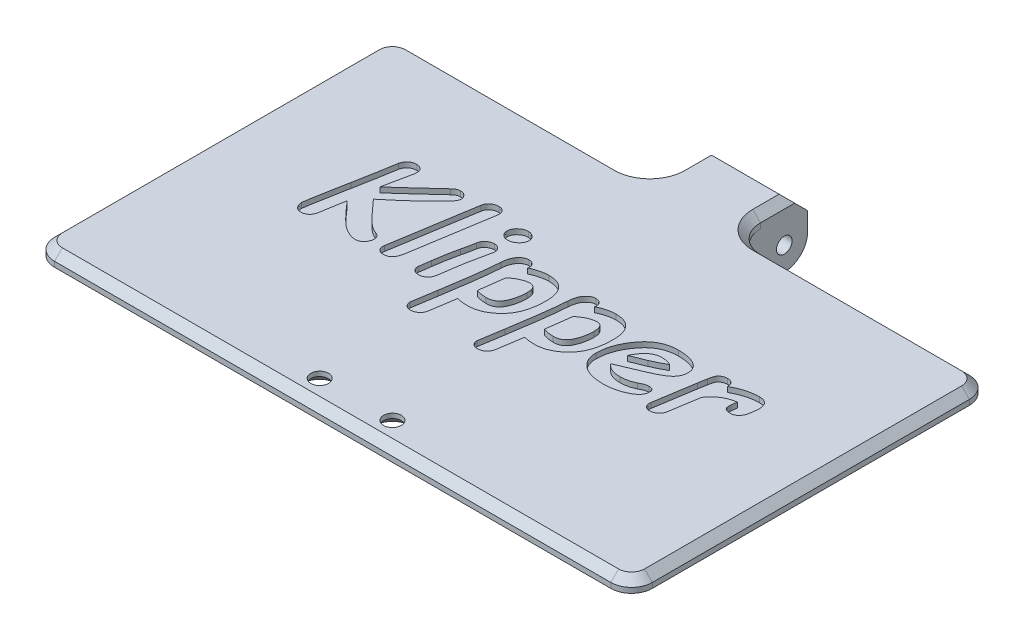
from build123d import *

# Parameters (mm, degrees)
SKETCH_1_W               = 115
SKETCH_1_H               = 69
EXTRUDE_1_DEPTH          = 2.5
SKETCH_2_W               = 16
SKETCH_2_H               = 9.88
EXTRUDE_2_DEPTH          = 2.5
EXTRUDE_3_DEPTH          = 8
EXTRUDE_3_DEPTH_BACK     = 8
SKETCH_3_R               = 4.5
SKETCH_3_R_2             = 1.5
EXTRUDE_4_DEPTH          = 16
FILLET_1_R               = 4
FILLET_2_R               = 5.3
CHAMFER_3_SIZE           = 4
CHAMFER_4_SIZE           = 5
CUT_EXTRUDE_1_REACH      = 78.064
SKETCH_5_W               = 6.532207719
SKETCH_5_H               = 9.476044153
SKETCH_5_W_2             = 6.58802864
CHAMFER_5_SIZE           = 1.5
CUT_EXTRUDE_2_DEPTH      = 1
SKETCH_7_R               = 1.5
CUT_EXTRUDE_3_DEPTH      = 10
HOLE_WIZARD_1_AT_2_COUNT = 2
HOLE_WIZARD_1_AT_2_PITCH = 14


with BuildPart() as part:
    # 草图1 → 凸台-拉伸1 (new body)
    with BuildSketch(Plane(origin=(0, 0, 0), x_dir=(1, 0, 0), z_dir=(0, 1, 0))):
        Rectangle(SKETCH_1_W, SKETCH_1_H)
    extrude(amount=EXTRUDE_1_DEPTH)

    # 草图2 → 凸台-拉伸2 (add)
    with BuildSketch(Plane(origin=(0, 2.5, 0), x_dir=(1, 0, 0), z_dir=(0, 1, 0))):
        with Locations((0, 39.44)):
            Rectangle(SKETCH_2_W, SKETCH_2_H)
    extrude(amount=-EXTRUDE_2_DEPTH)



with BuildPart() as body_2:
    # 草图3 → 凸台-拉伸3 (new, two sides: drawn at the far end of the back side and taken through both)
    with BuildSketch(Plane(origin=(0, 0, 0), x_dir=(0, 0, -1), z_dir=(1, 0, 0)).offset(-EXTRUDE_3_DEPTH_BACK)):
        with Locations((44.38, -5)):
            Circle(SKETCH_3_R)
        with Locations((44.38, -5)):
            Circle(SKETCH_3_R_2, mode=Mode.SUBTRACT)
    extrude(amount=EXTRUDE_3_DEPTH + EXTRUDE_3_DEPTH_BACK)


with BuildPart() as part_1:
    add(part.part)

    add(body_2.part)  # 凸台-拉伸4 merges body 2
    # 草图4 → 凸台-拉伸4 (add)
    with BuildSketch(Plane(origin=(8, 0, 0), x_dir=(0, 0, -1), z_dir=(1, 0, 0))):
        with BuildLine():
            Line((39.88, -5), (39.88, 2.5))
            Line((39.88, 2.5), (44.38, 2.5))
            Line((44.38, 2.5), (48.88, 2.5))
            Line((48.88, 2.5), (48.88, -5))
            Line((48.88, -5), (45.88, -5))
            ThreePointArc((45.88, -5), (44.38, -3.5), (42.88, -5))
            Line((42.88, -5), (39.88, -5))
        make_face()
    extrude(amount=-EXTRUDE_4_DEPTH)

    # 圆角1
    fillet_1_edges = [part_1.edges().sort_by_distance(p)[0] for p in [
        (57.5, 1.25, 34.5),
        (-57.5, 1.25, 34.5),
        (-57.5, 1.25, -34.5),
        (57.5, 1.25, -34.5),
    ]]
    fillet(fillet_1_edges, radius=FILLET_1_R)

    # 圆角2
    fillet_2_edges = [part_1.edges().sort_by_distance(p)[0] for p in [
        (8, 1.25, -34.5),
        (-8, 1.25, -34.5),
    ]]
    fillet(fillet_2_edges, radius=FILLET_2_R)

    # 倒角3
    chamfer_3_edges = [part_1.edges().sort_by_distance(p)[0] for p in [
        (0, 2.5, -48.88),
    ]]
    chamfer(chamfer_3_edges, length=CHAMFER_3_SIZE)

    # 倒角4
    chamfer_4_edges = [part_1.edges().sort_by_distance(p)[0] for p in [
        (0, 0, -39.88),
    ]]
    chamfer(chamfer_4_edges, length=CHAMFER_4_SIZE - 0.0001)  # a hair under: the kernel refuses the full size

    # 草图5 → 切除-拉伸1 (cut, up to next)
    with BuildSketch(Plane.XY, mode=Mode.PRIVATE) as cut_extrude_1_sk1:
        with Locations((-11.266103859, -4.738022077)):
            Rectangle(SKETCH_5_W, SKETCH_5_H)
    cut_extrude_1_tool1 = extrude(cut_extrude_1_sk1.sketch, amount=-CUT_EXTRUDE_1_REACH, mode=Mode.PRIVATE) & part_1.part
    # 草图5 → 切除-拉伸1 (cut, up to next)
    with BuildSketch(Plane.XY, mode=Mode.PRIVATE) as cut_extrude_1_sk2:
        with Locations((11.29401432, -4.738022077)):
            Rectangle(SKETCH_5_W_2, SKETCH_5_H)
    cut_extrude_1_tool2 = extrude(cut_extrude_1_sk2.sketch, amount=-CUT_EXTRUDE_1_REACH, mode=Mode.PRIVATE) & part_1.part
    add(cut_extrude_1_tool1.solids().sort_by_distance((-11.266104, -4.738022, 0))[0], mode=Mode.SUBTRACT)
    add(cut_extrude_1_tool2.solids().sort_by_distance((11.294014, -4.738022, 0))[0], mode=Mode.SUBTRACT)

    # 倒角5
    chamfer_5_edges = [part_1.edges().sort_by_distance(p)[0] for p in [
        (-8, 2.5, -42.34),
        (-57.5, 2.5, 0),
        (0, 2.5, 34.5),
        (57.5, 2.5, 0),
        (33.4, 2.5, -34.5),
        (56.328427125, 2.5, -33.328427125),
        (56.328427125, 2.5, 33.328427125),
        (-56.328427125, 2.5, 33.328427125),
        (-56.328427125, 2.5, -33.328427125),
        (-33.4, 2.5, -34.5),
        (8, 2.5, -42.34),
        (-9.55233406, 2.5, -36.05233406),
        (9.55233406, 2.5, -36.05233406),
    ]]
    chamfer(chamfer_5_edges, length=CHAMFER_5_SIZE)

    # 草图6 → 切除-拉伸2 (cut)
    # profile 1 of 8: a face of its own
    with BuildSketch(Plane(origin=(0, 2.5, 0), x_dir=(1, 0, 0), z_dir=(0, 1, 0))):
        with BuildLine():
            add(Edge.make_bspline(
                [(-34.7596989, -2.580431476), (-34.782081576, -2.68550518), (-34.826132819, -2.892300257), (-34.945223634, -3.185436858), (-35.116235559, -3.449182579), (-35.326182391, -3.683516785), (-35.570955763, -3.881601483), (-35.853189501, -4.017486584), (-36.159254779, -4.104849167), (-36.373448453, -4.114555759), (-36.482918356, -4.119516594)],
                knots=[0, 0, 0, 0, 1.021134815, 2.009690762, 2.99109389, 3.997912883, 4.994545801, 5.96555881, 6.960239698, 8, 8, 8, 8], degree=3))
            add(Edge.make_bspline(
                [(-36.482918356, -4.119516594), (-36.605371635, -4.113559535), (-36.837602445, -4.102262061), (-37.163298989, -3.997139622), (-37.441921766, -3.825227549), (-37.65872389, -3.582885479), (-37.824427553, -3.309599327), (-37.951994439, -3.025545741), (-38.028997049, -2.730361229), (-38.038219633, -2.531071917), (-38.042848871, -2.431039466)],
                knots=[0, 0, 0, 0, 1.14141121, 2.164669263, 3.161492256, 4.164639142, 5.170642093, 6.139766002, 7.066263201, 8, 8, 8, 8], degree=3))
            add(Edge.make_bspline(
                [(-38.042848871, -2.431039466), (-38.040602786, -2.39976677), (-38.034773977, -2.318611052), (-38.021390307, -2.168853523), (-37.992565285, -1.965021224), (-37.948624946, -1.707496228), (-37.901468877, -1.394392395), (-37.843018925, -1.026974693), (-37.768363311, -0.605910492), (-37.685481927, -0.129855686), (-37.591211461, 0.401619914), (-37.488404274, 0.98807478), (-37.368788027, 1.628012317), (-37.239466719, 2.322504999), (-37.105823889, 3.073699869), (-36.956541285, 3.878598476), (-36.791019208, 4.737034111), (-36.68171095, 5.328005545), (-36.625361899, 5.632654801)],
                knots=[0, 0, 0, 0, 0.183784855, 0.47693975, 0.881111405, 1.390003718, 2.00829355, 2.737042932, 3.570699548, 4.514851944, 5.569501986, 6.734651007, 8.004833705, 9.385520732, 10.875491024, 12.477186854, 14.183969069, 16, 16, 16, 16], degree=3))
            add(Edge.make_bspline(
                [(-36.625361899, 5.632654801), (-36.549574675, 6.023987802), (-36.401883005, 6.786604789), (-36.194652462, 7.902290306), (-35.998775911, 8.960535439), (-35.819322211, 9.961339889), (-35.651846282, 10.905049524), (-35.498183921, 11.789505576), (-35.362860156, 12.617777346), (-35.279400908, 13.150851173), (-35.239143023, 13.407987748)],
                knots=[0, 0, 0, 0, 1.21119589, 2.360339037, 3.448096115, 4.481401348, 5.449877681, 6.360467923, 7.209145824, 8, 8, 8, 8], degree=3))
            add(Edge.make_bspline(
                [(-35.239143023, 13.407987748), (-35.212861345, 13.515801404), (-35.1606366, 13.730039656), (-35.014159889, 14.029055053), (-34.814464878, 14.300708642), (-34.570961605, 14.54338601), (-34.292858529, 14.749143256), (-33.985513746, 14.897227963), (-33.657737043, 14.987946932), (-33.431956683, 14.997722147), (-33.317892299, 15.002660592)],
                knots=[0, 0, 0, 0, 0.984283338, 1.955885296, 2.936121954, 3.969883521, 5.001592343, 5.996213444, 6.987685735, 8, 8, 8, 8], degree=3))
            add(Edge.make_bspline(
                [(-33.317892299, 15.002660592), (-33.222570261, 14.997785719), (-33.036224117, 14.988255775), (-32.767380287, 14.919531757), (-32.527037782, 14.793360001), (-32.316109996, 14.627431), (-32.138756296, 14.425356071), (-32.013882693, 14.188278886), (-31.932707355, 13.925075428), (-31.925150105, 13.739822271), (-31.921250724, 13.644235577)],
                knots=[0, 0, 0, 0, 1.0498553, 2.052374159, 3.027991965, 4.018179449, 4.99504746, 5.965312959, 6.9501447, 8, 8, 8, 8], degree=3))
            add(Edge.make_bspline(
                [(-31.921250724, 13.644235577), (-31.922116159, 13.610638789), (-31.924059012, 13.535215938), (-31.934670223, 13.409840336), (-31.956669919, 13.261808223), (-31.985423722, 13.08824812), (-32.019092809, 12.890009602), (-32.061736996, 12.666666262), (-32.109346514, 12.419526595), (-32.147768258, 12.247497), (-32.167921251, 12.15726395)],
                knots=[0, 0, 0, 0, 0.534416193, 1.199733496, 1.99934538, 2.913736552, 3.997694676, 5.19693574, 6.529735328, 8, 8, 8, 8], degree=3))
            Line((-32.167921251, 12.15726395), (-33.095541401, 7.710246))
            add(Edge.make_bspline(
                [(-33.095541401, 7.710246), (-33.071091839, 7.728609765), (-33.00454831, 7.778589789), (-32.883138016, 7.880929526), (-32.714196479, 8.030643251), (-32.493802321, 8.22597191), (-32.225497984, 8.468555864), (-31.902027899, 8.753930185), (-31.53441054, 9.090753257), (-31.111443168, 9.468898957), (-30.642762395, 9.896625222), (-30.127432586, 10.372818479), (-29.557017325, 10.890730575), (-28.942757304, 11.461558992), (-28.269443882, 12.069775913), (-27.555548284, 12.733201926), (-26.78610713, 13.436592624), (-26.259148145, 13.924206493), (-25.987261146, 14.175793191)],
                knots=[0, 0, 0, 0, 0.152717834, 0.415646855, 0.792756665, 1.280347358, 1.886599977, 2.599491844, 3.434921134, 4.376976659, 5.43342272, 6.604286436, 7.881753593, 9.281818112, 10.792750873, 12.413843217, 14.14970533, 16, 16, 16, 16], degree=3))
            add(Edge.make_bspline(
                [(-25.987261146, 14.175793191), (-25.885998351, 14.267633275), (-25.691113446, 14.444383736), (-25.359691347, 14.639661489), (-25.010686848, 14.757406286), (-24.772139196, 14.772687626), (-24.653155761, 14.780309694)],
                knots=[0, 0, 0, 0, 1.089728316, 2.097232233, 3.05093241, 4, 4, 4, 4], degree=3))
            add(Edge.make_bspline(
                [(-24.653155761, 14.780309694), (-24.556563292, 14.775896314), (-24.368534961, 14.767305162), (-24.098196654, 14.692455059), (-23.854039911, 14.564514198), (-23.640771895, 14.389828039), (-23.459360049, 14.184988788), (-23.329279736, 13.950015895), (-23.243395642, 13.695277316), (-23.235972133, 13.516389126), (-23.232194557, 13.425358912)],
                knots=[0, 0, 0, 0, 1.060102912, 2.063612007, 3.054123836, 4.067830886, 5.078337085, 6.041320095, 7.003293336, 8, 8, 8, 8], degree=3))
            add(Edge.make_bspline(
                [(-23.232194557, 13.425358912), (-23.240692459, 13.343162794), (-23.259772507, 13.158610653), (-23.400493081, 12.875453989), (-23.598094373, 12.547253275), (-23.830005672, 12.250451162), (-24.068551177, 11.977201758), (-24.302183975, 11.725300705), (-24.5791008, 11.427902188), (-24.910250107, 11.097605087), (-25.286157797, 10.723043509), (-25.713987826, 10.312474589), (-26.185229964, 9.855993865), (-26.890442577, 9.189812212), (-27.837820725, 8.313627894), (-29.046952507, 7.240885452), (-30.337872929, 6.139156433), (-31.231119423, 5.402066765), (-31.688477128, 5.024664066)],
                knots=[0, 0, 0, 0, 0.327637796, 0.735633966, 1.243936428, 1.860776083, 2.234417901, 2.692570758, 3.232289055, 3.856775775, 4.55973, 5.351061715, 6.224176387, 7.17923422, 9.224317807, 11.376173153, 13.632520422, 16, 16, 16, 16], degree=3))
            add(Edge.make_bspline(
                [(-31.688477128, 5.024664066), (-31.466252324, 4.776721822), (-31.040991767, 4.302247077), (-30.430471217, 3.62507098), (-29.873079951, 3.013979543), (-29.367347473, 2.472677522), (-28.920496522, 1.992042784), (-28.518567772, 1.587751149), (-28.17767055, 1.242966951), (-27.801115117, 0.883321867), (-27.376640141, 0.51572459), (-26.885356644, 0.157732914), (-26.426481114, -0.131022468), (-26.113096815, -0.258867461), (-25.96641575, -0.31870594)],
                knots=[0, 0, 0, 0, 1.519905865, 2.908568284, 4.16209537, 5.295493841, 6.290285084, 7.157562653, 7.897711698, 8.503472759, 9.534450484, 10.457548255, 11.27804786, 12, 12, 12, 12], degree=3))
            add(Edge.make_bspline(
                [(-25.96641575, -0.31870594), (-25.884542702, -0.347979349), (-25.72846447, -0.403784551), (-25.515702579, -0.515822181), (-25.338566622, -0.649161949), (-25.186988634, -0.795137803), (-25.076315434, -0.965146572), (-24.993645967, -1.149991129), (-24.944646342, -1.353856336), (-24.937991633, -1.496207725), (-24.934568616, -1.569429738)],
                knots=[0, 0, 0, 0, 1.192233374, 2.272807498, 3.283467117, 4.22733224, 5.144053513, 6.047595842, 6.99573187, 8, 8, 8, 8], degree=3))
            add(Edge.make_bspline(
                [(-24.934568616, -1.569429738), (-24.940428957, -1.680143614), (-24.952253933, -1.903541721), (-25.055426787, -2.231746616), (-25.224182799, -2.549480247), (-25.448485702, -2.849542164), (-25.714182326, -3.118955323), (-26.02957944, -3.310238929), (-26.373490689, -3.431868012), (-26.615088045, -3.445530417), (-26.737695426, -3.452463902)],
                knots=[0, 0, 0, 0, 0.923676221, 1.863790951, 2.846588829, 3.919100602, 4.986928418, 5.986317366, 6.978083386, 8, 8, 8, 8], degree=3))
            add(Edge.make_bspline(
                [(-26.737695426, -3.452463902), (-26.820072139, -3.449556154), (-26.991577811, -3.443502317), (-27.255505622, -3.39916027), (-27.535269033, -3.328857934), (-27.829142303, -3.229914757), (-28.14050768, -3.109621998), (-28.462428922, -2.95283445), (-28.80431279, -2.777583206), (-29.096764064, -2.604693731), (-29.345238732, -2.444772683), (-29.549354836, -2.298830191), (-29.768241853, -2.128252783), (-29.999519066, -1.932906926), (-30.248731359, -1.717869881), (-30.506543344, -1.4726275), (-30.786049193, -1.210253323), (-31.07726486, -0.91998983), (-31.385441876, -0.609701347), (-31.707091917, -0.273485613), (-32.041760464, 0.086641043), (-32.393944416, 0.468821625), (-32.758316242, 0.876757893), (-33.140633589, 1.306417941), (-33.536591785, 1.761677279), (-33.80340271, 2.07480408), (-33.939779965, 2.234855149)],
                knots=[0, 0, 0, 0, 0.630752578, 1.313206621, 2.044626928, 2.838409765, 3.68666814, 4.599220912, 5.579120216, 6.628755953, 7.199531255, 7.841901334, 8.549818224, 9.324337947, 10.160405316, 11.070368056, 12.049102511, 13.096524813, 14.219208385, 15.398588192, 16.659999799, 17.984569225, 19.378958644, 20.849202291, 22.389506938, 24, 24, 24, 24], degree=3))
            Line((-33.939779965, 2.234855149), (-34.7596989, -2.580431476))
        make_face()
    # profile 2 of 8: a face of its own
    with BuildSketch(Plane(origin=(0, 2.5, 0), x_dir=(1, 0, 0), z_dir=(0, 1, 0))):
        with BuildLine():
            add(Edge.make_bspline(
                [(-19.556456283, -1.027449426), (-19.588361717, -1.200932991), (-19.648508863, -1.527978888), (-19.794808719, -1.979567429), (-19.980888529, -2.362981657), (-20.209258715, -2.680449716), (-20.479373299, -2.930642249), (-20.794908897, -3.10324934), (-21.147455316, -3.212786984), (-21.396951733, -3.224196019), (-21.526346265, -3.230113004)],
                knots=[0, 0, 0, 0, 1.297396948, 2.445812933, 3.482796037, 4.422306199, 5.309419356, 6.168058867, 7.04991355, 8, 8, 8, 8], degree=3))
            add(Edge.make_bspline(
                [(-21.526346265, -3.230113004), (-21.635734319, -3.224989694), (-21.8461064, -3.215136684), (-22.143375891, -3.134019657), (-22.405182836, -2.999286752), (-22.625266278, -2.811093468), (-22.794974224, -2.575639519), (-22.901543028, -2.299856081), (-22.93985251, -1.988585512), (-22.912864853, -1.775385951), (-22.898668211, -1.663234023)],
                knots=[0, 0, 0, 0, 1.083143594, 2.083071814, 3.027962504, 3.980633635, 4.926918381, 5.875707267, 6.882532758, 8, 8, 8, 8], degree=3))
            Line((-22.898668211, -1.663234023), (-20.31731326, 14.394669856))
            add(Edge.make_bspline(
                [(-20.31731326, 14.394669856), (-20.295310273, 14.502688585), (-20.251929753, 14.715655522), (-20.106907589, 15.007113595), (-19.912164958, 15.268538937), (-19.661205286, 15.485621429), (-19.379444597, 15.666635251), (-19.074324837, 15.793712924), (-18.75751972, 15.880464558), (-18.540239171, 15.888178846), (-18.430804864, 15.892064182)],
                knots=[0, 0, 0, 0, 1.006847702, 1.985074944, 2.955492673, 3.978280321, 5.009191558, 6.012955664, 6.999216348, 8, 8, 8, 8], degree=3))
            add(Edge.make_bspline(
                [(-18.430804864, 15.892064182), (-18.320407774, 15.886578221), (-18.110579712, 15.876151239), (-17.812903386, 15.80180395), (-17.56131098, 15.661858899), (-17.352607353, 15.475770011), (-17.195877153, 15.247654025), (-17.090574741, 14.987254278), (-17.054429352, 14.696127111), (-17.073112705, 14.497621725), (-17.082802548, 14.394669856)],
                knots=[0, 0, 0, 0, 1.136648018, 2.160388941, 3.126186404, 4.0717555, 5.014313222, 5.950819147, 6.937222803, 8, 8, 8, 8], degree=3))
            Line((-17.082802548, 14.394669856), (-19.556456283, -1.027449426))
        make_face()
    # profile 3 of 8: a face of its own
    with BuildSketch(Plane(origin=(0, 2.5, 0), x_dir=(1, 0, 0), z_dir=(0, 1, 0))):
        with BuildLine():
            add(Edge.make_bspline(
                [(-13.542559351, 12.577646116), (-13.53473354, 12.70837807), (-13.519195927, 12.967937395), (-13.387653887, 13.340588749), (-13.172536213, 13.68172603), (-12.880946766, 13.980682257), (-12.545200282, 14.232483885), (-12.182678, 14.422714829), (-11.80034703, 14.534222529), (-11.539771319, 14.550042537), (-11.409380428, 14.557958797)],
                knots=[0, 0, 0, 0, 0.976472606, 1.938719366, 2.920105073, 3.974721026, 5.0461972, 6.050367501, 7.02441284, 8, 8, 8, 8], degree=3))
            add(Edge.make_bspline(
                [(-11.409380428, 14.557958797), (-11.301152906, 14.552661295), (-11.089707847, 14.542311518), (-10.7865578, 14.459997566), (-10.508520701, 14.325760817), (-10.265222139, 14.138150635), (-10.060020779, 13.915985091), (-9.910645134, 13.662687307), (-9.813850455, 13.385893106), (-9.805211489, 13.191075786), (-9.800810654, 13.091832566)],
                knots=[0, 0, 0, 0, 1.07260025, 2.095548521, 3.092545499, 4.117556947, 5.126272087, 6.074184263, 7.018957071, 8, 8, 8, 8], degree=3))
            add(Edge.make_bspline(
                [(-9.800810654, 13.091832566), (-9.808455154, 12.963291933), (-9.823637585, 12.708002612), (-9.958873658, 12.341501582), (-10.16702866, 11.996572688), (-10.458909607, 11.694345034), (-10.791460171, 11.430205344), (-11.161085375, 11.240691097), (-11.552798127, 11.122783931), (-11.821995932, 11.108387225), (-11.958309207, 11.101097187)],
                knots=[0, 0, 0, 0, 0.951266743, 1.889272175, 2.865311042, 3.923669907, 4.989821158, 6.004871583, 6.989729916, 8, 8, 8, 8], degree=3))
            add(Edge.make_bspline(
                [(-11.958309207, 11.101097187), (-12.067722675, 11.106224506), (-12.279262699, 11.116137665), (-12.582757425, 11.199369338), (-12.858433255, 11.335312975), (-13.095852626, 11.528458541), (-13.29475935, 11.753823954), (-13.435207497, 12.010773353), (-13.528600772, 12.286393716), (-13.537860614, 12.479604727), (-13.542559351, 12.577646116)],
                knots=[0, 0, 0, 0, 1.087958025, 2.103458276, 3.109154329, 4.126747858, 5.132443911, 6.082304911, 7.02690076, 8, 8, 8, 8], degree=3))
        make_face()
    # profile 4 of 8: a face of its own
    with BuildSketch(Plane(origin=(0, 2.5, 0), x_dir=(1, 0, 0), z_dir=(0, 1, 0))):
        with BuildLine():
            add(Edge.make_bspline(
                [(-14.762015055, -3.230113004), (-14.864261658, -3.225203642), (-15.060617943, -3.21577561), (-15.341197541, -3.150522474), (-15.587733044, -3.034217103), (-15.799087891, -2.875757769), (-15.971826605, -2.682110883), (-16.089170414, -2.454067301), (-16.16751996, -2.204504707), (-16.175417046, -2.028659233), (-16.179502027, -1.937698412)],
                knots=[0, 0, 0, 0, 1.138709474, 2.186798939, 3.185045338, 4.15248048, 5.112318298, 6.047127448, 6.989823926, 8, 8, 8, 8], degree=3))
            Line((-16.179502027, -1.937698412), (-15.852924146, 0.414357175))
            add(Edge.make_bspline(
                [(-15.852924146, 0.414357175), (-15.798144457, 0.808400518), (-15.688703122, 1.595638101), (-15.489784698, 2.767875884), (-15.26399242, 3.930719759), (-15.093742081, 4.699597353), (-15.008685582, 5.083726023)],
                knots=[0, 0, 0, 0, 1.005695868, 2.009224617, 3.005415288, 4, 4, 4, 4], degree=3))
            add(Edge.make_bspline(
                [(-15.008685582, 5.083726023), (-14.976241151, 5.220374668), (-14.913297767, 5.485478035), (-14.82215908, 5.870669083), (-14.741913448, 6.231958708), (-14.673350061, 6.569408893), (-14.610171242, 6.880583134), (-14.556896614, 7.167652198), (-14.516393826, 7.429802539), (-14.492075886, 7.596739503), (-14.4806022, 7.675503672)],
                knots=[0, 0, 0, 0, 1.273829399, 2.471275618, 3.590035044, 4.630306841, 5.594343694, 6.469923251, 7.278079454, 8, 8, 8, 8], degree=3))
            add(Edge.make_bspline(
                [(-14.4806022, 7.675503672), (-14.459118865, 7.778634025), (-14.416230668, 7.98451802), (-14.279323564, 8.273453342), (-14.0870594, 8.537848888), (-13.846574311, 8.773947349), (-13.567850924, 8.971625513), (-13.262901775, 9.114143677), (-12.940021087, 9.207518151), (-12.717495803, 9.216816401), (-12.604516503, 9.221537256)],
                knots=[0, 0, 0, 0, 0.956439664, 1.909385686, 2.883847439, 3.920233297, 4.964580578, 5.978681794, 6.973747553, 8, 8, 8, 8], degree=3))
            add(Edge.make_bspline(
                [(-12.604516503, 9.221537256), (-12.507907144, 9.218424054), (-12.320062476, 9.212370825), (-12.0541084, 9.140080309), (-11.814562017, 9.028160616), (-11.609698972, 8.870660088), (-11.440023525, 8.678104773), (-11.316511506, 8.453150171), (-11.245708962, 8.198490828), (-11.236806877, 8.021055102), (-11.232194557, 7.929122665)],
                knots=[0, 0, 0, 0, 1.09266557, 2.124549891, 3.099475247, 4.073781463, 5.032299369, 5.99009753, 6.958635682, 8, 8, 8, 8], degree=3))
            add(Edge.make_bspline(
                [(-11.232194557, 7.929122665), (-11.23378839, 7.881583527), (-11.237573501, 7.768685291), (-11.265727293, 7.571834849), (-11.307186445, 7.321861908), (-11.363708967, 7.01600328), (-11.436159385, 6.656850164), (-11.5284593, 6.24291523), (-11.631092, 5.77327009), (-11.795320465, 5.080473126), (-11.991186029, 4.185031117), (-12.206218834, 3.112174368), (-12.380362612, 2.05590139), (-12.507389423, 1.194856969), (-12.587157212, 0.534336485), (-12.651834774, 0.085597794), (-12.706018082, -0.321238268), (-12.758251189, -0.684876834), (-12.808525589, -1.00639414), (-12.846480346, -1.287616231), (-12.891395034, -1.524147925), (-12.932925098, -1.779479578), (-13.005590166, -2.058910715), (-13.151824635, -2.353715919), (-13.340306848, -2.616835656), (-13.579288278, -2.832859559), (-13.844984914, -3.012254988), (-14.136812729, -3.13600063), (-14.443722208, -3.217873189), (-14.654939746, -3.225995469), (-14.762015055, -3.230113004)],
                knots=[0, 0, 0, 0, 0.322359572, 0.765555065, 1.346524576, 2.041201369, 2.874406528, 3.830969721, 4.916998514, 6.134252916, 8.658957479, 11.132394356, 13.553096052, 15.917554617, 17.033826652, 18.064468152, 18.991831392, 19.817004037, 20.55557042, 21.19861341, 21.740874872, 22.187604621, 22.953512502, 23.687555981, 24.406960821, 25.134930052, 25.860225802, 26.570702698, 27.275427355, 28, 28, 28, 28], degree=3))
        make_face()
    # profile 5 of 8: a face of its own
    with BuildSketch(Plane(origin=(0, 2.5, 0), x_dir=(1, 0, 0), z_dir=(0, 1, 0))):
        with BuildLine():
            Line((-7.024898668, -3.438566971), (-7.775332947, -8.281647457))
            add(Edge.make_bspline(
                [(-7.775332947, -8.281647457), (-7.798037747, -8.395080547), (-7.842274743, -8.61608841), (-7.975507798, -8.928177483), (-8.164457525, -9.206252173), (-8.402172684, -9.448862199), (-8.673566418, -9.651745682), (-8.977658372, -9.794372924), (-9.302108927, -9.886486386), (-9.526876957, -9.895873775), (-9.640995947, -9.90063993)],
                knots=[0, 0, 0, 0, 1.028679374, 2.00423202, 3.000199769, 4.007224716, 5.018522883, 6.001631955, 6.985390658, 8, 8, 8, 8], degree=3))
            add(Edge.make_bspline(
                [(-9.640995947, -9.90063993), (-9.743336802, -9.896189278), (-9.939028491, -9.887678937), (-10.215516237, -9.817300017), (-10.457949365, -9.700528465), (-10.665109349, -9.540164381), (-10.828108347, -9.340165883), (-10.949546653, -9.114245037), (-11.020447315, -8.861373512), (-11.029500998, -8.685101541), (-11.034163289, -8.594328407)],
                knots=[0, 0, 0, 0, 1.143451998, 2.186458709, 3.165492567, 4.134536023, 5.09147086, 6.030173325, 6.985616721, 8, 8, 8, 8], degree=3))
            add(Edge.make_bspline(
                [(-11.034163289, -8.594328407), (-11.033027096, -8.575798475), (-11.030042741, -8.527127261), (-11.023810842, -8.438911499), (-11.008425193, -8.318581997), (-10.988470262, -8.167898224), (-10.958544285, -7.985402459), (-10.929695915, -7.771780353), (-10.888937233, -7.526829091), (-10.849516255, -7.250681012), (-10.799625218, -6.942818385), (-10.743965452, -6.604861432), (-10.685129608, -6.234052546), (-10.619854112, -5.833230839), (-10.544914412, -5.400633686), (-10.470603982, -4.93685586), (-10.385994956, -4.441400933), (-10.327745966, -4.100985362), (-10.297625941, -3.924959559)],
                knots=[0, 0, 0, 0, 0.188484642, 0.495078793, 0.897585586, 1.419696611, 2.038271735, 2.774867537, 3.607981702, 4.559092372, 5.606750676, 6.774226419, 8.036431359, 9.418457593, 10.897128288, 12.493705281, 14.18692682, 16, 16, 16, 16], degree=3))
            add(Edge.make_bspline(
                [(-10.297625941, -3.924959559), (-10.208482575, -3.377366743), (-10.034837867, -2.310696287), (-9.800413538, -0.752565762), (-9.587725312, 0.718114191), (-9.398821566, 2.099448087), (-9.239306096, 3.394448094), (-9.102594729, 4.600997608), (-8.993921778, 5.721045189), (-8.938148509, 6.438587802), (-8.911407064, 6.782625849)],
                knots=[0, 0, 0, 0, 1.232850281, 2.401501507, 3.501327808, 4.534941776, 5.499553253, 6.400717126, 7.233196543, 8, 8, 8, 8], degree=3))
            add(Edge.make_bspline(
                [(-8.911407064, 6.782625849), (-8.902916403, 6.903290672), (-8.886442279, 7.137412292), (-8.830386563, 7.476406952), (-8.768346464, 7.796898672), (-8.679523729, 8.094181031), (-8.580831294, 8.372492843), (-8.456773524, 8.626841513), (-8.320205217, 8.863575115), (-8.161896014, 9.076020981), (-7.994180599, 9.265335384), (-7.817855348, 9.429270025), (-7.642098642, 9.574316509), (-7.456539788, 9.690260239), (-7.264211404, 9.77682987), (-7.067457716, 9.840529113), (-6.865470613, 9.879795652), (-6.728598896, 9.885656838), (-6.660104227, 9.888589949)],
                knots=[0, 0, 0, 0, 1.376467188, 2.670709843, 3.909420132, 5.090356905, 6.200017972, 7.267512375, 8.307785023, 9.307313562, 10.278611088, 11.183461385, 12.046312211, 12.86956518, 13.666199147, 14.441821715, 15.220241345, 16, 16, 16, 16], degree=3))
            add(Edge.make_bspline(
                [(-6.660104227, 9.888589949), (-6.556421793, 9.884938913), (-6.356064999, 9.87788362), (-6.074770809, 9.795060458), (-5.82631523, 9.6649951), (-5.623425077, 9.482041563), (-5.459154719, 9.26867006), (-5.361483296, 9.019754227), (-5.316684145, 8.750018777), (-5.336573728, 8.566083044), (-5.346844239, 8.471102977)],
                knots=[0, 0, 0, 0, 1.115562366, 2.155721949, 3.134073485, 4.116804236, 5.081494341, 6.011992395, 6.973439834, 8, 8, 8, 8], degree=3))
            Line((-5.346844239, 8.471102977), (-5.395483497, 8.359927528))
            add(Edge.make_bspline(
                [(-5.395483497, 8.359927528), (-5.253534709, 8.428130495), (-4.974522419, 8.562189166), (-4.553332518, 8.742749839), (-4.132617008, 8.885524704), (-3.7186059, 9.010181761), (-3.307282007, 9.102462777), (-2.901943079, 9.1744453), (-2.498701998, 9.212325045), (-2.231682639, 9.218470564), (-2.098436595, 9.221537256)],
                knots=[0, 0, 0, 0, 1.099165911, 2.160503111, 3.195758938, 4.198346771, 5.176761183, 6.136161042, 7.069920743, 8, 8, 8, 8], degree=3))
            add(Edge.make_bspline(
                [(-2.098436595, 9.221537256), (-1.937252147, 9.218840357), (-1.623130116, 9.213584542), (-1.169336454, 9.154620028), (-0.743889385, 9.072600836), (-0.354312932, 8.940711527), (0.008506707, 8.78174287), (0.339420228, 8.583903512), (0.637355619, 8.347148961), (0.908135112, 8.079720991), (1.141017017, 7.770199737), (1.342329071, 7.426501685), (1.518834947, 7.049785486), (1.653863899, 6.633300099), (1.767583456, 6.184694103), (1.839860601, 5.698165393), (1.891684799, 5.177496733), (1.895147417, 4.817512341), (1.896931094, 4.632075762)],
                knots=[0, 0, 0, 0, 1.109021349, 2.16130056, 3.146460954, 4.086952091, 4.986394188, 5.869753465, 6.732725901, 7.600986389, 8.482869047, 9.390858524, 10.339795291, 11.340800181, 12.400544594, 13.522645048, 14.723855151, 16, 16, 16, 16], degree=3))
            add(Edge.make_bspline(
                [(1.896931094, 4.632075762), (1.891531514, 4.3040899), (1.881031248, 3.666273908), (1.78248585, 2.739069151), (1.620672456, 1.872076082), (1.396153025, 1.063800588), (1.104172854, 0.317424705), (0.748580228, -0.369882016), (0.326165147, -0.996749274), (-0.16023993, -1.556523149), (-0.688154835, -2.049359433), (-1.234705416, -2.48482412), (-1.803000144, -2.850782581), (-2.389980492, -3.15288302), (-2.998037192, -3.386865869), (-3.626586902, -3.555019478), (-4.275998426, -3.653315686), (-4.71536709, -3.667608668), (-4.936884771, -3.674814799)],
                knots=[0, 0, 0, 0, 1.306130071, 2.539959016, 3.708871028, 4.815848908, 5.876350195, 6.895597035, 7.892275819, 8.879968279, 9.84266507, 10.76554703, 11.659963433, 12.530581036, 13.390686296, 14.250036637, 15.117716265, 16, 16, 16, 16], degree=3))
            add(Edge.make_bspline(
                [(-4.936884771, -3.674814799), (-5.121138952, -3.672645618), (-5.483276902, -3.668382252), (-6.016532038, -3.619886114), (-6.530402398, -3.551651652), (-6.862071949, -3.475803263), (-7.024898668, -3.438566971)],
                knots=[0, 0, 0, 0, 1.049421037, 2.062559345, 3.048851173, 4, 4, 4, 4], degree=3))
        make_face()
        with BuildLine():
            add(Edge.make_bspline(
                [(-5.829762594, 4.687663487), (-5.848097313, 4.525509997), (-5.88608935, 4.189505866), (-5.948951265, 3.668401536), (-6.018332337, 3.112504687), (-6.095514424, 2.520822955), (-6.177191561, 1.892746168), (-6.273575454, 1.229842806), (-6.369139926, 0.531120108), (-6.437486263, 0.054157611), (-6.472495657, -0.190159327)],
                knots=[0, 0, 0, 0, 0.795998798, 1.649417997, 2.560281296, 3.528608175, 4.560014493, 5.649687931, 6.796087634, 8, 8, 8, 8], degree=3))
            add(Edge.make_bspline(
                [(-6.472495657, -0.190159327), (-6.30768201, -0.242881678), (-5.979211838, -0.347956226), (-5.471890682, -0.453384396), (-4.95622632, -0.523358059), (-4.608225062, -0.530509817), (-4.433121019, -0.534108372)],
                knots=[0, 0, 0, 0, 0.99893786, 1.990862388, 2.989060784, 4, 4, 4, 4], degree=3))
            add(Edge.make_bspline(
                [(-4.433121019, -0.534108372), (-4.3020292, -0.52902687), (-4.047385022, -0.519156119), (-3.677904999, -0.454490468), (-3.338218001, -0.336235259), (-3.02136355, -0.183285229), (-2.740122567, 0.028758726), (-2.485718158, 0.28015131), (-2.256516973, 0.57611156), (-2.063423263, 0.915525979), (-1.89632704, 1.282894552), (-1.747544192, 1.664764383), (-1.616217065, 2.057848255), (-1.517718872, 2.46644977), (-1.437824895, 2.886209029), (-1.378122262, 3.318576294), (-1.342759508, 3.76291518), (-1.339317941, 4.063396012), (-1.337579618, 4.21516783)],
                knots=[0, 0, 0, 0, 0.991713451, 1.926390674, 2.823880128, 3.705281224, 4.575997213, 5.474127625, 6.404485139, 7.397551621, 8.420457065, 9.454997828, 10.496523691, 11.552389865, 12.631259228, 13.727589156, 14.852213222, 16, 16, 16, 16], degree=3))
            add(Edge.make_bspline(
                [(-1.337579618, 4.21516783), (-1.341843329, 4.362387891), (-1.349867912, 4.639465642), (-1.401258813, 5.026850534), (-1.497561343, 5.355823121), (-1.633039057, 5.62856553), (-1.811688001, 5.843181158), (-2.034163001, 5.995218922), (-2.295013734, 6.08968861), (-2.483238036, 6.097568581), (-2.581354951, 6.101676226)],
                knots=[0, 0, 0, 0, 1.381009602, 2.599150079, 3.654104656, 4.581961589, 5.437303415, 6.241749902, 7.083465451, 8, 8, 8, 8], degree=3))
            add(Edge.make_bspline(
                [(-2.581354951, 6.101676226), (-2.706698354, 6.097723264), (-2.962539328, 6.089654792), (-3.349284669, 6.019939249), (-3.744646251, 5.907555506), (-4.147080519, 5.749287794), (-4.558886703, 5.550701092), (-4.976709187, 5.304567285), (-5.404141079, 5.015816153), (-5.685009646, 4.799267493), (-5.829762594, 4.687663487)],
                knots=[0, 0, 0, 0, 0.8330094, 1.700272455, 2.604726154, 3.562926838, 4.572133379, 5.642014751, 6.784750739, 8, 8, 8, 8], degree=3))
        make_face(mode=Mode.SUBTRACT)
    # profile 6 of 8: a face of its own
    with BuildSketch(Plane(origin=(0, 2.5, 0), x_dir=(1, 0, 0), z_dir=(0, 1, 0))):
        with BuildLine():
            Line((5.871453387, -3.438566971), (5.121019108, -8.281647457))
            add(Edge.make_bspline(
                [(5.121019108, -8.281647457), (5.098314309, -8.395080547), (5.054077312, -8.61608841), (4.920844258, -8.928177483), (4.731894531, -9.206252173), (4.494179372, -9.448862199), (4.222785638, -9.651745682), (3.918693684, -9.794372924), (3.594243129, -9.886486386), (3.369475099, -9.895873775), (3.255356109, -9.90063993)],
                knots=[0, 0, 0, 0, 1.028679374, 2.00423202, 3.000199769, 4.007224716, 5.018522883, 6.001631955, 6.985390658, 8, 8, 8, 8], degree=3))
            add(Edge.make_bspline(
                [(3.255356109, -9.90063993), (3.153015254, -9.896189278), (2.957323564, -9.887678937), (2.680835818, -9.817300017), (2.43840269, -9.700528465), (2.231242707, -9.540164381), (2.068243709, -9.340165883), (1.946805403, -9.114245037), (1.875904741, -8.861373512), (1.866851058, -8.685101541), (1.862188767, -8.594328407)],
                knots=[0, 0, 0, 0, 1.143451998, 2.186458709, 3.165492567, 4.134536023, 5.09147086, 6.030173325, 6.985616721, 8, 8, 8, 8], degree=3))
            add(Edge.make_bspline(
                [(1.862188767, -8.594328407), (1.86332496, -8.575798475), (1.866309315, -8.527127261), (1.872541213, -8.438911499), (1.887926862, -8.318581997), (1.907881794, -8.167898224), (1.93780777, -7.985402459), (1.966656141, -7.771780353), (2.007414823, -7.526829091), (2.046835801, -7.250681012), (2.096726838, -6.942818385), (2.152386604, -6.604861432), (2.211222448, -6.234052546), (2.276497944, -5.833230839), (2.351437644, -5.400633686), (2.425748074, -4.93685586), (2.510357099, -4.441400933), (2.56860609, -4.100985362), (2.598726115, -3.924959559)],
                knots=[0, 0, 0, 0, 0.188484642, 0.495078793, 0.897585586, 1.419696611, 2.038271735, 2.774867537, 3.607981702, 4.559092372, 5.606750676, 6.774226419, 8.036431359, 9.418457593, 10.897128288, 12.493705281, 14.18692682, 16, 16, 16, 16], degree=3))
            add(Edge.make_bspline(
                [(2.598726115, -3.924959559), (2.68786948, -3.377366743), (2.861514188, -2.310696287), (3.095938517, -0.752565762), (3.308626743, 0.718114191), (3.49753049, 2.099448087), (3.657045959, 3.394448094), (3.793757326, 4.600997608), (3.902430277, 5.721045189), (3.958203546, 6.438587802), (3.984944991, 6.782625849)],
                knots=[0, 0, 0, 0, 1.232850281, 2.401501507, 3.501327808, 4.534941776, 5.499553253, 6.400717126, 7.233196543, 8, 8, 8, 8], degree=3))
            add(Edge.make_bspline(
                [(3.984944991, 6.782625849), (3.993435652, 6.903290672), (4.009909777, 7.137412292), (4.065965493, 7.476406952), (4.128005592, 7.796898672), (4.216828326, 8.094181031), (4.315520761, 8.372492843), (4.439578532, 8.626841513), (4.576146839, 8.863575115), (4.734456042, 9.076020981), (4.902171456, 9.265335384), (5.078496707, 9.429270025), (5.254253414, 9.574316509), (5.439812267, 9.690260239), (5.632140652, 9.77682987), (5.82889434, 9.840529113), (6.030881443, 9.879795652), (6.16775316, 9.885656838), (6.236247829, 9.888589949)],
                knots=[0, 0, 0, 0, 1.376467188, 2.670709843, 3.909420132, 5.090356905, 6.200017972, 7.267512375, 8.307785023, 9.307313562, 10.278611088, 11.183461385, 12.046312211, 12.86956518, 13.666199147, 14.441821715, 15.220241345, 16, 16, 16, 16], degree=3))
            add(Edge.make_bspline(
                [(6.236247829, 9.888589949), (6.339930263, 9.884938913), (6.540287057, 9.87788362), (6.821581246, 9.795060458), (7.070036826, 9.6649951), (7.272926978, 9.482041563), (7.437197336, 9.26867006), (7.53486876, 9.019754227), (7.579667911, 8.750018777), (7.559778328, 8.566083044), (7.549507817, 8.471102977)],
                knots=[0, 0, 0, 0, 1.115562366, 2.155721949, 3.134073485, 4.116804236, 5.081494341, 6.011992395, 6.973439834, 8, 8, 8, 8], degree=3))
            Line((7.549507817, 8.471102977), (7.500868558, 8.359927528))
            add(Edge.make_bspline(
                [(7.500868558, 8.359927528), (7.642817346, 8.428130495), (7.921829636, 8.562189166), (8.343019537, 8.742749839), (8.763735047, 8.885524704), (9.177746155, 9.010181761), (9.589070048, 9.102462777), (9.994408976, 9.1744453), (10.397650057, 9.212325045), (10.664669417, 9.218470564), (10.79791546, 9.221537256)],
                knots=[0, 0, 0, 0, 1.099165911, 2.160503111, 3.195758938, 4.198346771, 5.176761183, 6.136161042, 7.069920743, 8, 8, 8, 8], degree=3))
            add(Edge.make_bspline(
                [(10.79791546, 9.221537256), (10.959099909, 9.218840357), (11.273221939, 9.213584542), (11.727015602, 9.154620028), (12.15246267, 9.072600836), (12.542039124, 8.940711527), (12.904858762, 8.78174287), (13.235772284, 8.583903512), (13.533707674, 8.347148961), (13.804487167, 8.079720991), (14.037369072, 7.770199737), (14.238681127, 7.426501685), (14.415187003, 7.049785486), (14.550215955, 6.633300099), (14.663935511, 6.184694103), (14.736212657, 5.698165393), (14.788036855, 5.177496733), (14.791499473, 4.817512341), (14.79328315, 4.632075762)],
                knots=[0, 0, 0, 0, 1.109021349, 2.16130056, 3.146460954, 4.086952091, 4.986394188, 5.869753465, 6.732725901, 7.600986389, 8.482869047, 9.390858524, 10.339795291, 11.340800181, 12.400544594, 13.522645048, 14.723855151, 16, 16, 16, 16], degree=3))
            add(Edge.make_bspline(
                [(14.79328315, 4.632075762), (14.78788357, 4.3040899), (14.777383304, 3.666273908), (14.678837906, 2.739069151), (14.517024512, 1.872076082), (14.292505081, 1.063800588), (14.00052491, 0.317424705), (13.644932284, -0.369882016), (13.222517203, -0.996749274), (12.736112126, -1.556523149), (12.208197221, -2.049359433), (11.66164664, -2.48482412), (11.093351912, -2.850782581), (10.506371564, -3.15288302), (9.898314864, -3.386865869), (9.269765154, -3.555019478), (8.62035363, -3.653315686), (8.180984965, -3.667608668), (7.959467284, -3.674814799)],
                knots=[0, 0, 0, 0, 1.306130071, 2.539959016, 3.708871028, 4.815848908, 5.876350195, 6.895597035, 7.892275819, 8.879968279, 9.84266507, 10.76554703, 11.659963433, 12.530581036, 13.390686296, 14.250036637, 15.117716265, 16, 16, 16, 16], degree=3))
            add(Edge.make_bspline(
                [(7.959467284, -3.674814799), (7.775213103, -3.672645618), (7.413075154, -3.668382252), (6.879820018, -3.619886114), (6.365949657, -3.551651652), (6.034280106, -3.475803263), (5.871453387, -3.438566971)],
                knots=[0, 0, 0, 0, 1.049421037, 2.062559345, 3.048851173, 4, 4, 4, 4], degree=3))
        make_face()
        with BuildLine():
            add(Edge.make_bspline(
                [(7.066589461, 4.687663487), (7.048254742, 4.525509997), (7.010262705, 4.189505866), (6.947400791, 3.668401536), (6.878019719, 3.112504687), (6.800837631, 2.520822955), (6.719160495, 1.892746168), (6.622776602, 1.229842806), (6.52721213, 0.531120108), (6.458865792, 0.054157611), (6.423856398, -0.190159327)],
                knots=[0, 0, 0, 0, 0.795998798, 1.649417997, 2.560281296, 3.528608175, 4.560014493, 5.649687931, 6.796087634, 8, 8, 8, 8], degree=3))
            add(Edge.make_bspline(
                [(6.423856398, -0.190159327), (6.588670045, -0.242881678), (6.917140217, -0.347956226), (7.424461373, -0.453384396), (7.940125735, -0.523358059), (8.288126993, -0.530509817), (8.463231036, -0.534108372)],
                knots=[0, 0, 0, 0, 0.99893786, 1.990862388, 2.989060784, 4, 4, 4, 4], degree=3))
            add(Edge.make_bspline(
                [(8.463231036, -0.534108372), (8.594322855, -0.52902687), (8.848967034, -0.519156119), (9.218447057, -0.454490468), (9.558134055, -0.336235259), (9.874988506, -0.183285229), (10.156229488, 0.028758726), (10.410633898, 0.28015131), (10.639835083, 0.57611156), (10.832928792, 0.915525979), (11.000025016, 1.282894552), (11.148807863, 1.664764383), (11.280134991, 2.057848255), (11.378633183, 2.46644977), (11.45852716, 2.886209029), (11.518229794, 3.318576294), (11.553592548, 3.76291518), (11.557034114, 4.063396012), (11.558772438, 4.21516783)],
                knots=[0, 0, 0, 0, 0.991713451, 1.926390674, 2.823880128, 3.705281224, 4.575997213, 5.474127625, 6.404485139, 7.397551621, 8.420457065, 9.454997828, 10.496523691, 11.552389865, 12.631259228, 13.727589156, 14.852213222, 16, 16, 16, 16], degree=3))
            add(Edge.make_bspline(
                [(11.558772438, 4.21516783), (11.554508726, 4.362387891), (11.546484143, 4.639465642), (11.495093242, 5.026850534), (11.398790713, 5.355823121), (11.263312999, 5.62856553), (11.084664055, 5.843181158), (10.862189055, 5.995218922), (10.601338322, 6.08968861), (10.41311402, 6.097568581), (10.314997105, 6.101676226)],
                knots=[0, 0, 0, 0, 1.381009602, 2.599150079, 3.654104656, 4.581961589, 5.437303415, 6.241749902, 7.083465451, 8, 8, 8, 8], degree=3))
            add(Edge.make_bspline(
                [(10.314997105, 6.101676226), (10.189653702, 6.097723264), (9.933812728, 6.089654792), (9.547067387, 6.019939249), (9.151705805, 5.907555506), (8.749271537, 5.749287794), (8.337465352, 5.550701092), (7.919642869, 5.304567285), (7.492210976, 5.015816153), (7.21134241, 4.799267493), (7.066589461, 4.687663487)],
                knots=[0, 0, 0, 0, 0.8330094, 1.700272455, 2.604726154, 3.562926838, 4.572133379, 5.642014751, 6.784750739, 8, 8, 8, 8], degree=3))
        make_face(mode=Mode.SUBTRACT)
    # profile 7 of 8: a face of its own
    with BuildSketch(Plane(origin=(0, 2.5, 0), x_dir=(1, 0, 0), z_dir=(0, 1, 0))):
        with BuildLine():
            add(Edge.make_bspline(
                [(18.569774175, 0.438676805), (18.65642489, 0.336651584), (18.828732182, 0.133771672), (19.130635988, -0.126076112), (19.460442419, -0.349563582), (19.824612792, -0.524726946), (20.217985011, -0.66552818), (20.642106319, -0.765009981), (21.097334399, -0.82442174), (21.410354741, -0.832306965), (21.571511291, -0.836366623)],
                knots=[0, 0, 0, 0, 0.949001083, 1.88711433, 2.817414051, 3.7696856, 4.747416236, 5.778344452, 6.856194648, 8, 8, 8, 8], degree=3))
            add(Edge.make_bspline(
                [(21.571511291, -0.836366623), (21.822210439, -0.82851198), (22.313912885, -0.813106474), (23.028624231, -0.687726363), (23.704941669, -0.490801791), (24.120473946, -0.289837553), (24.326577881, -0.190159327)],
                knots=[0, 0, 0, 0, 1.052390484, 2.064079517, 3.039783789, 4, 4, 4, 4], degree=3))
            add(Edge.make_bspline(
                [(24.326577881, -0.190159327), (24.494419434, -0.104005179), (24.805664873, 0.055759105), (25.253379833, 0.236994429), (25.640598105, 0.357467575), (25.882404803, 0.375161925), (25.990735379, 0.38308908)],
                knots=[0, 0, 0, 0, 1.275124684, 2.364591692, 3.267329131, 4, 4, 4, 4], degree=3))
            add(Edge.make_bspline(
                [(25.990735379, 0.38308908), (26.072007586, 0.380842958), (26.224205559, 0.376636659), (26.436819742, 0.335096288), (26.617952772, 0.266156291), (26.768423126, 0.168400106), (26.884694815, 0.037602566), (26.963470362, -0.122214375), (27.013570107, -0.307647717), (27.019468803, -0.439950736), (27.022582513, -0.509788743)],
                knots=[0, 0, 0, 0, 1.248348048, 2.337773881, 3.313128954, 4.211859415, 5.069437633, 5.969225631, 6.928027227, 8, 8, 8, 8], degree=3))
            add(Edge.make_bspline(
                [(27.022582513, -0.509788743), (27.017678494, -0.622706318), (27.007970878, -0.846229167), (26.916145521, -1.17253737), (26.767123848, -1.481187428), (26.563193922, -1.776514382), (26.297092759, -2.052277937), (25.974610285, -2.312026422), (25.596123484, -2.559165079), (25.167422963, -2.787323591), (24.702985354, -2.990081234), (24.224552739, -3.176833057), (23.732935169, -3.328855727), (23.230396131, -3.453448873), (22.717269707, -3.556051944), (22.191363921, -3.623631215), (21.655630802, -3.667065333), (21.294816328, -3.672217398), (21.112912565, -3.674814799)],
                knots=[0, 0, 0, 0, 0.742510839, 1.469816689, 2.213697945, 2.992438673, 3.823458147, 4.728980371, 5.714992527, 6.79694517, 7.923976931, 9.051731414, 10.178556598, 11.310920433, 12.461461169, 13.6234779, 14.801882011, 16, 16, 16, 16], degree=3))
            add(Edge.make_bspline(
                [(21.112912565, -3.674814799), (20.892786784, -3.670323929), (20.464556268, -3.661587435), (19.840611406, -3.608073963), (19.255001648, -3.50862639), (18.703892304, -3.380278858), (18.190379254, -3.204970587), (17.713879248, -2.99300824), (17.271145176, -2.747080174), (16.872910711, -2.45708735), (16.513135949, -2.139102725), (16.203091814, -1.788617086), (15.935213334, -1.415473051), (15.719662038, -1.013290301), (15.550628733, -0.585568021), (15.434492425, -0.13019535), (15.358691282, 0.350450637), (15.350077468, 0.68041901), (15.345686161, 0.848636272)],
                knots=[0, 0, 0, 0, 1.27879691, 2.487758857, 3.633510352, 4.726709527, 5.771240056, 6.780089286, 7.753018486, 8.707089633, 9.636143818, 10.536703831, 11.419603095, 12.298495231, 13.180445733, 14.084391369, 15.023426293, 16, 16, 16, 16], degree=3))
            add(Edge.make_bspline(
                [(15.345686161, 0.848636272), (15.351418441, 1.089849427), (15.362902014, 1.573075765), (15.46508895, 2.293690871), (15.624709621, 3.008400658), (15.848385395, 3.717716072), (16.139352122, 4.420586334), (16.490953123, 5.119768427), (16.906373324, 5.813171545), (17.380111427, 6.48941907), (17.90042573, 7.128272341), (18.477003045, 7.69011101), (19.099603024, 8.160757169), (19.760171179, 8.55180849), (20.465190688, 8.851607164), (21.210151608, 9.067645475), (21.997625935, 9.199595044), (22.536831794, 9.214126567), (22.811812391, 9.221537256)],
                knots=[0, 0, 0, 0, 0.932029701, 1.867150648, 2.807699445, 3.760568704, 4.738228079, 5.745261977, 6.783263419, 7.860034023, 8.934764661, 9.963680852, 10.963795257, 11.945025189, 12.923749933, 13.916866367, 14.93765744, 16, 16, 16, 16], degree=3))
            add(Edge.make_bspline(
                [(22.811812391, 9.221537256), (22.991369915, 9.219898026), (23.340423556, 9.216711419), (23.849600144, 9.181653124), (24.328360061, 9.122424676), (24.776852576, 9.044741849), (25.19379563, 8.940210095), (25.579860032, 8.810832825), (25.938550169, 8.664217288), (26.262957676, 8.489951242), (26.551952781, 8.294623558), (26.808805614, 8.08445179), (27.023178743, 7.848585538), (27.198050695, 7.593460249), (27.335585696, 7.31902115), (27.434052822, 7.024546924), (27.488711676, 6.709367322), (27.497528809, 6.493306698), (27.502026636, 6.38308908)],
                knots=[0, 0, 0, 0, 1.405299931, 2.731854671, 3.992246625, 5.180040671, 6.29249682, 7.353111712, 8.364877895, 9.322014563, 10.229622295, 11.091965779, 11.913314481, 12.715378701, 13.505885493, 14.308512979, 15.137132599, 16, 16, 16, 16], degree=3))
            add(Edge.make_bspline(
                [(27.502026636, 6.38308908), (27.500083766, 6.277487025), (27.496261346, 6.069724576), (27.444413677, 5.766140901), (27.3676147, 5.475507638), (27.264998244, 5.195052125), (27.122958549, 4.929634727), (26.952553467, 4.67628027), (26.753289231, 4.434506108), (26.518643166, 4.204798237), (26.240196684, 3.979571255), (25.912726916, 3.746122792), (25.526625592, 3.509617424), (25.087681766, 3.262280263), (24.59350767, 3.009467906), (24.042436629, 2.749330312), (23.436745413, 2.479092161), (23.011416076, 2.302212576), (22.790966995, 2.210535519)],
                knots=[0, 0, 0, 0, 0.754968911, 1.485332733, 2.197022366, 2.905180019, 3.617014428, 4.345730368, 5.08752687, 5.85530807, 6.691570165, 7.648328229, 8.731601137, 9.930322433, 11.253685457, 12.703295411, 14.291311141, 16, 16, 16, 16], degree=3))
            Line((22.790966995, 2.210535519), (18.569774175, 0.438676805))
        make_face()
        with BuildLine():
            Line((18.778228141, 3.416094292), (21.616676317, 4.569539572))
            add(Edge.make_bspline(
                [(21.616676317, 4.569539572), (21.867351548, 4.683053609), (22.357251408, 4.904896472), (23.06429744, 5.248108554), (23.72743998, 5.590562248), (24.146743691, 5.83150024), (24.35089751, 5.948809984)],
                knots=[0, 0, 0, 0, 1.077703487, 2.106178527, 3.077921622, 4, 4, 4, 4], degree=3))
            add(Edge.make_bspline(
                [(24.35089751, 5.948809984), (24.225615454, 6.018530536), (23.961312085, 6.165617655), (23.497184596, 6.295900695), (22.967885985, 6.380552906), (22.591036321, 6.389024583), (22.391430226, 6.393511779)],
                knots=[0, 0, 0, 0, 0.843293427, 1.779067967, 2.823638143, 4, 4, 4, 4], degree=3))
            add(Edge.make_bspline(
                [(22.391430226, 6.393511779), (22.213194155, 6.385689221), (21.858931724, 6.370141086), (21.343288407, 6.217378793), (20.851414595, 5.982489673), (20.382702623, 5.651851982), (19.94191159, 5.22614829), (19.524406098, 4.708550391), (19.12635445, 4.101537903), (18.897713689, 3.651355469), (18.778228141, 3.416094292)],
                knots=[0, 0, 0, 0, 0.862893474, 1.71508909, 2.587283078, 3.499283627, 4.485035137, 5.551408365, 6.720388651, 8, 8, 8, 8], degree=3))
        make_face(mode=Mode.SUBTRACT)
    # profile 8 of 8: a face of its own
    with BuildSketch(Plane(origin=(0, 2.5, 0), x_dir=(1, 0, 0), z_dir=(0, 1, 0))):
        with BuildLine():
            add(Edge.make_bspline(
                [(40.141285466, 5.417252369), (40.121615355, 5.309773973), (40.08223523, 5.094599148), (39.95873588, 4.785057186), (39.790802563, 4.487862647), (39.577663559, 4.209431746), (39.321453436, 3.957897148), (38.995485267, 3.78723313), (38.622912499, 3.67950649), (38.356350711, 3.668524164), (38.21656051, 3.662764819)],
                knots=[0, 0, 0, 0, 0.915406499, 1.832670018, 2.781793637, 3.773584631, 4.771078351, 5.767434136, 6.829198908, 8, 8, 8, 8], degree=3))
            add(Edge.make_bspline(
                [(38.21656051, 3.662764819), (38.119059793, 3.665901616), (37.936572244, 3.671772614), (37.680373468, 3.719781003), (37.462594721, 3.801647243), (37.28128121, 3.918460774), (37.141539129, 4.073054674), (37.042835422, 4.261734625), (36.988433473, 4.483211323), (36.980459324, 4.63988641), (36.976259409, 4.722405815)],
                knots=[0, 0, 0, 0, 1.253223821, 2.345600656, 3.335731247, 4.227943274, 5.092505575, 5.985214656, 6.938830093, 8, 8, 8, 8], degree=3))
            add(Edge.make_bspline(
                [(36.976259409, 4.722405815), (36.978807234, 4.783865966), (36.98415899, 4.912964199), (37.001773182, 5.040976514), (37.011001737, 5.108045652)],
                knots=[0, 0, 0, 0, 0.952145516, 2, 2, 2, 2], degree=3))
            Line((37.011001737, 5.108045652), (37.11522872, 6.21980014))
            add(Edge.make_bspline(
                [(37.11522872, 6.21980014), (36.896453413, 6.181593172), (36.465291848, 6.106295021), (35.84559442, 5.914864836), (35.260780881, 5.672711659), (34.714635274, 5.367501642), (34.205718104, 5.003631386), (33.730351101, 4.584948419), (33.29323132, 4.106424908), (33.037709057, 3.75229331), (32.907932831, 3.572434766)],
                knots=[0, 0, 0, 0, 1.039364011, 2.048374747, 3.030624264, 3.999542461, 4.971901413, 5.955752307, 6.961754856, 8, 8, 8, 8], degree=3))
            Line((32.907932831, 3.572434766), (31.990735379, -2.146152379))
            add(Edge.make_bspline(
                [(31.990735379, -2.146152379), (31.96931183, -2.249320568), (31.926542985, -2.455280099), (31.789731239, -2.741564783), (31.604754839, -3.003975343), (31.374393197, -3.237509249), (31.105176681, -3.432358996), (30.803836241, -3.573934264), (30.474924631, -3.660103839), (30.246042951, -3.669824633), (30.128546613, -3.674814799)],
                knots=[0, 0, 0, 0, 0.962019097, 1.92052417, 2.879733079, 3.89216828, 4.910529874, 5.906838542, 6.925476227, 8, 8, 8, 8], degree=3))
            add(Edge.make_bspline(
                [(30.128546613, -3.674814799), (30.024781511, -3.670266934), (29.827359999, -3.661614252), (29.551887022, -3.574741977), (29.31433059, -3.436815774), (29.121436093, -3.242294794), (28.979196484, -3.004425111), (28.890435767, -2.731637103), (28.859758095, -2.427402192), (28.883007259, -2.217803181), (28.895193978, -2.107935818)],
                knots=[0, 0, 0, 0, 1.074035305, 2.043439171, 2.964861946, 3.899748222, 4.854133304, 5.815756678, 6.855065915, 8, 8, 8, 8], degree=3))
            Line((28.895193978, -2.107935818), (30.104226983, 5.542324749))
            Line((30.104226983, 5.542324749), (30.396062536, 7.213430713))
            add(Edge.make_bspline(
                [(30.396062536, 7.213430713), (30.416371818, 7.339991155), (30.454222937, 7.575866286), (30.530844081, 7.896727332), (30.608785586, 8.161479784), (30.697055781, 8.376141023), (30.80488624, 8.556481419), (30.945150281, 8.70849878), (31.105114108, 8.853055514), (31.292972579, 8.980570557), (31.503035938, 9.08930656), (31.734578363, 9.163400731), (31.980256025, 9.216218698), (32.150250227, 9.21973464), (32.237405906, 9.221537256)],
                knots=[0, 0, 0, 0, 1.514707039, 2.823012593, 3.89695552, 4.774182395, 5.560730372, 6.36564931, 7.209222473, 8.105366613, 9.042104661, 9.994517271, 10.971793119, 12, 12, 12, 12], degree=3))
            add(Edge.make_bspline(
                [(32.237405906, 9.221537256), (32.340799682, 9.218012773), (32.535850098, 9.2113639), (32.81044786, 9.149437724), (33.043533063, 9.040877373), (33.239482181, 8.890842308), (33.39153546, 8.694425614), (33.498356258, 8.454800168), (33.569083995, 8.176210775), (33.579763762, 7.975918816), (33.585408222, 7.870060707)],
                knots=[0, 0, 0, 0, 1.139802255, 2.150215538, 3.081941427, 3.956074917, 4.848142166, 5.791449224, 6.832738925, 8, 8, 8, 8], degree=3))
            add(Edge.make_bspline(
                [(33.585408222, 7.870060707), (33.778645263, 7.977978725), (34.161474849, 8.191779403), (34.75411577, 8.465472105), (35.351742104, 8.698270906), (35.954340259, 8.89211238), (36.564861477, 9.035946933), (37.180302564, 9.146001244), (37.802951509, 9.209183422), (38.21990017, 9.217417808), (38.428488709, 9.221537256)],
                knots=[0, 0, 0, 0, 1.043838367, 2.067989705, 3.076458039, 4.068228451, 5.051460098, 6.033187926, 7.016055223, 8, 8, 8, 8], degree=3))
            add(Edge.make_bspline(
                [(38.428488709, 9.221537256), (38.579709385, 9.216830704), (38.864901443, 9.207954461), (39.263371726, 9.107821454), (39.606155234, 8.949779032), (39.886930158, 8.716599825), (40.098651222, 8.41433563), (40.247461235, 8.05133085), (40.337614254, 7.62655425), (40.347800013, 7.322774049), (40.353213665, 7.161317222)],
                knots=[0, 0, 0, 0, 1.121269939, 2.114639939, 3.030611164, 3.904259829, 4.792490272, 5.744956892, 6.801462028, 8, 8, 8, 8], degree=3))
            add(Edge.make_bspline(
                [(40.353213665, 7.161317222), (40.348113156, 7.005853677), (40.337335784, 6.677359346), (40.286294708, 6.352630787), (40.25940938, 6.181583579)],
                knots=[0, 0, 0, 0, 0.946521934, 2, 2, 2, 2], degree=3))
            Line((40.25940938, 6.181583579), (40.141285466, 5.417252369))
        make_face()
    extrude(amount=-CUT_EXTRUDE_2_DEPTH, mode=Mode.SUBTRACT)

    # 草图7 → 切除-拉伸3 (cut)
    with BuildSketch(Plane.XZ):
        with Locations(Location((-7, 30, 0), (0, 0, 270))):
            Circle(SKETCH_7_R)
        with Locations(Location((7, 30, 0), (0, 0, 90))):
            Circle(SKETCH_7_R)
    extrude(amount=-CUT_EXTRUDE_3_DEPTH, mode=Mode.SUBTRACT)

    # 草图9 → 打孔尺寸(%根据十字)槽半沉头木螺钉的类型1 (revolve, cut)
    with BuildSketch(Plane(origin=(7, 0, 30), x_dir=(0, 0, -1), z_dir=(1, 0, 0))):
        Polygon((0, 0), (0, 2.5), (1.7, 2.5), (1.7, 1.6), (3.3, 0), align=None)
    hole_wizard_1 = revolve(axis=Axis((7, -6.35, 30), (0, 1, 0)), mode=Mode.SUBTRACT)

    # 打孔尺寸(%根据十字)槽半沉头木螺钉的类型1 at 2: 打孔尺寸(%根据十字)槽半沉头木螺钉的类型1 ×2
    with Locations(*[(-i * HOLE_WIZARD_1_AT_2_PITCH, 0, 0) for i in range(1, HOLE_WIZARD_1_AT_2_COUNT)]):
        add(hole_wizard_1, mode=Mode.SUBTRACT)


solid = part_1.part
